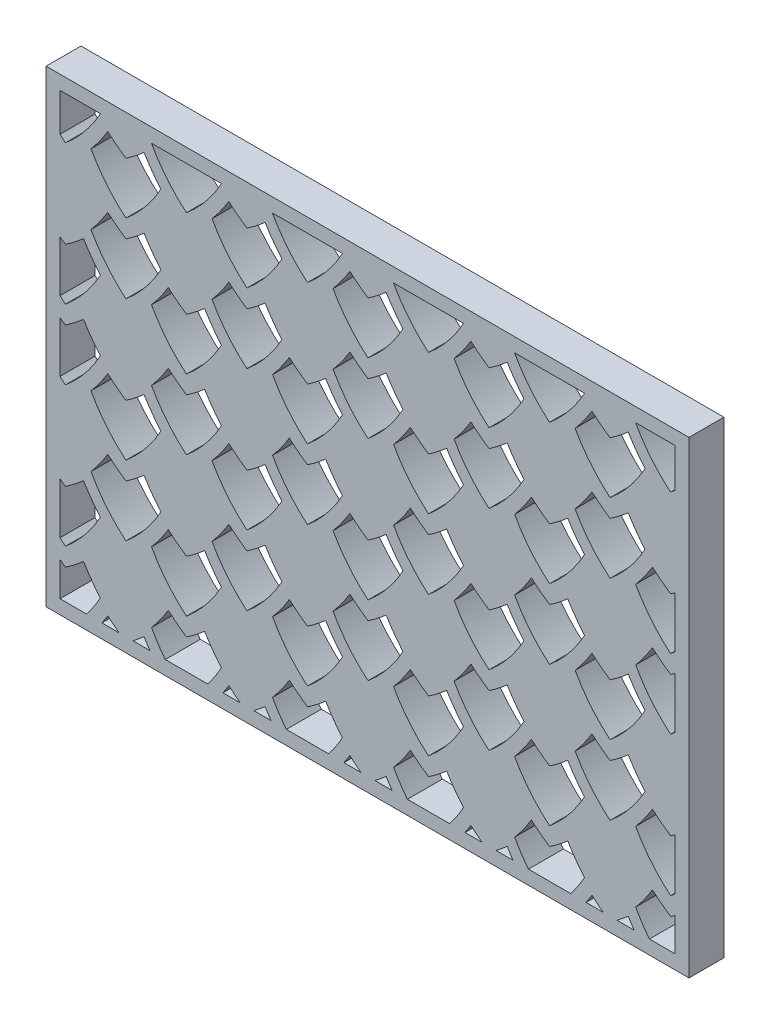
from build123d import *

# Parameters (mm, degrees)
SKETCH3_W           = 88
SKETCH3_H           = 63
BOSS_EXTRUDE2_DEPTH = 5
CUT_EXTRUDE1_DEPTH  = 70.169565835
SKETCH4_W           = 92
SKETCH4_H           = 67
SKETCH4_W_2         = 88
SKETCH4_H_2         = 63
BOSS_EXTRUDE3_DEPTH = 5


with BuildPart() as part:
    # Sketch3 → Boss-Extrude2 (new body)
    with BuildSketch(Plane.XY):
        with Locations((-6.36239225, 15.649319027)):
            Rectangle(SKETCH3_W, SKETCH3_H)
    extrude(amount=BOSS_EXTRUDE2_DEPTH)

    # Sketch1 → Cut-Extrude1 (cut, through all)
    with BuildSketch(Plane.XY):
        with BuildLine():
            ThreePointArc((-49.596586343, -68.963266791), (-52.378979429, -66.149375756), (-54.596645072, -62.871929626))
            ThreePointArc((-54.596645072, -62.871929626), (-53.324323575, -61.255666412), (-52.190717032, -59.539261747))
            ThreePointArc((-52.190717032, -59.539261747), (-50.926871084, -60.58383646), (-49.596586343, -61.542369412))
            ThreePointArc((-49.596586343, -61.542369412), (-48.266301602, -60.58383646), (-47.002455654, -59.539261747))
            ThreePointArc((-47.002455654, -59.539261747), (-45.868849111, -61.255666412), (-44.596527614, -62.871929626))
            ThreePointArc((-44.596527614, -62.871929626), (-46.814193257, -66.149375756), (-49.596586343, -68.963266791))
        make_face()
        with BuildLine():
            ThreePointArc((-40.936332305, -63.963266791), (-43.718725391, -61.149375756), (-45.936391034, -57.871929626))
            ThreePointArc((-45.936391034, -57.871929626), (-44.664069538, -56.255666412), (-43.530462994, -54.539261747))
            ThreePointArc((-43.530462994, -54.539261747), (-42.266617046, -55.58383646), (-40.936332305, -56.542369412))
            ThreePointArc((-40.936332305, -56.542369412), (-39.606047564, -55.58383646), (-38.342201616, -54.539261747))
            ThreePointArc((-38.342201616, -54.539261747), (-37.208595073, -56.255666412), (-35.936273576, -57.871929626))
            ThreePointArc((-35.936273576, -57.871929626), (-38.153939219, -61.149375756), (-40.936332305, -63.963266791))
        make_face()
        with BuildLine():
            ThreePointArc((-32.276078267, -58.963266791), (-35.058471353, -56.149375756), (-37.276136997, -52.871929626))
            ThreePointArc((-37.276136997, -52.871929626), (-36.0038155, -51.255666412), (-34.870208956, -49.539261747))
            ThreePointArc((-34.870208956, -49.539261747), (-33.606363008, -50.58383646), (-32.276078267, -51.542369412))
            ThreePointArc((-32.276078267, -51.542369412), (-30.945793527, -50.58383646), (-29.681947579, -49.539261747))
            ThreePointArc((-29.681947579, -49.539261747), (-28.548341035, -51.255666412), (-27.276019538, -52.871929626))
            ThreePointArc((-27.276019538, -52.871929626), (-29.493685181, -56.149375756), (-32.276078267, -58.963266791))
        make_face()
        with BuildLine():
            ThreePointArc((-23.61582423, -53.963266791), (-26.398217316, -51.149375756), (-28.615882959, -47.871929626))
            ThreePointArc((-28.615882959, -47.871929626), (-27.343561462, -46.255666412), (-26.209954918, -44.539261747))
            ThreePointArc((-26.209954918, -44.539261747), (-24.94610897, -45.58383646), (-23.61582423, -46.542369412))
            ThreePointArc((-23.61582423, -46.542369412), (-22.285539489, -45.58383646), (-21.021693541, -44.539261747))
            ThreePointArc((-21.021693541, -44.539261747), (-19.888086997, -46.255666412), (-18.6157655, -47.871929626))
            ThreePointArc((-18.6157655, -47.871929626), (-20.833431144, -51.149375756), (-23.61582423, -53.963266791))
        make_face()
        with BuildLine():
            ThreePointArc((-14.955570192, -48.963266791), (-17.737963278, -46.149375756), (-19.955628921, -42.871929626))
            ThreePointArc((-19.955628921, -42.871929626), (-18.683307424, -41.255666412), (-17.549700881, -39.539261747))
            ThreePointArc((-17.549700881, -39.539261747), (-16.285854933, -40.58383646), (-14.955570192, -41.542369412))
            ThreePointArc((-14.955570192, -41.542369412), (-13.625285451, -40.58383646), (-12.361439503, -39.539261747))
            ThreePointArc((-12.361439503, -39.539261747), (-11.227832959, -41.255666412), (-9.955511463, -42.871929626))
            ThreePointArc((-9.955511463, -42.871929626), (-12.173177106, -46.149375756), (-14.955570192, -48.963266791))
        make_face()
        with BuildLine():
            ThreePointArc((-6.295316154, -43.963266791), (-9.07770924, -41.149375756), (-11.295374883, -37.871929626))
            ThreePointArc((-11.295374883, -37.871929626), (-10.023053386, -36.255666412), (-8.889446843, -34.539261747))
            ThreePointArc((-8.889446843, -34.539261747), (-7.625600895, -35.58383646), (-6.295316154, -36.542369412))
            ThreePointArc((-6.295316154, -36.542369412), (-4.965031413, -35.58383646), (-3.701185465, -34.539261747))
            ThreePointArc((-3.701185465, -34.539261747), (-2.567578922, -36.255666412), (-1.295257425, -37.871929626))
            ThreePointArc((-1.295257425, -37.871929626), (-3.512923068, -41.149375756), (-6.295316154, -43.963266791))
        make_face()
        with BuildLine():
            ThreePointArc((2.364937884, -38.963266791), (-0.417455202, -36.149375756), (-2.635120845, -32.871929626))
            ThreePointArc((-2.635120845, -32.871929626), (-1.362799348, -31.255666412), (-0.229192805, -29.539261747))
            ThreePointArc((-0.229192805, -29.539261747), (1.034653143, -30.58383646), (2.364937884, -31.542369412))
            ThreePointArc((2.364937884, -31.542369412), (3.695222625, -30.58383646), (4.959068573, -29.539261747))
            ThreePointArc((4.959068573, -29.539261747), (6.092675116, -31.255666412), (7.364996613, -32.871929626))
            ThreePointArc((7.364996613, -32.871929626), (5.14733097, -36.149375756), (2.364937884, -38.963266791))
        make_face()
        with BuildLine():
            ThreePointArc((11.025191922, -33.963266791), (8.242798836, -31.149375756), (6.025133193, -27.871929626))
            ThreePointArc((6.025133193, -27.871929626), (7.29745469, -26.255666412), (8.431061233, -24.539261747))
            ThreePointArc((8.431061233, -24.539261747), (9.694907181, -25.58383646), (11.025191922, -26.542369412))
            ThreePointArc((11.025191922, -26.542369412), (12.355476663, -25.58383646), (13.619322611, -24.539261747))
            ThreePointArc((13.619322611, -24.539261747), (14.752929154, -26.255666412), (16.025250651, -27.871929626))
            ThreePointArc((16.025250651, -27.871929626), (13.807585008, -31.149375756), (11.025191922, -33.963266791))
        make_face()
        with BuildLine():
            ThreePointArc((28.345699997, -23.963266791), (25.563306912, -21.149375756), (23.345641268, -17.871929626))
            ThreePointArc((23.345641268, -17.871929626), (24.617962765, -16.255666412), (25.751569309, -14.539261747))
            ThreePointArc((25.751569309, -14.539261747), (27.015415257, -15.58383646), (28.345699997, -16.542369412))
            ThreePointArc((28.345699997, -16.542369412), (29.675984738, -15.58383646), (30.939830686, -14.539261747))
            ThreePointArc((30.939830686, -14.539261747), (32.07343723, -16.255666412), (33.345758727, -17.871929626))
            ThreePointArc((33.345758727, -17.871929626), (31.128093083, -21.149375756), (28.345699997, -23.963266791))
        make_face()
        with BuildLine():
            ThreePointArc((37.005954035, -18.963266791), (34.223560949, -16.149375756), (32.005895306, -12.871929626))
            ThreePointArc((32.005895306, -12.871929626), (33.278216803, -11.255666412), (34.411823347, -9.539261747))
            ThreePointArc((34.411823347, -9.539261747), (35.675669295, -10.58383646), (37.005954035, -11.542369412))
            ThreePointArc((37.005954035, -11.542369412), (38.336238776, -10.58383646), (39.600084724, -9.539261747))
            ThreePointArc((39.600084724, -9.539261747), (40.733691268, -11.255666412), (42.006012764, -12.871929626))
            ThreePointArc((42.006012764, -12.871929626), (39.788347121, -16.149375756), (37.005954035, -18.963266791))
        make_face()
        with BuildLine():
            ThreePointArc((-40.936332305, -53.963266791), (-43.718725391, -51.149375756), (-45.936391034, -47.871929626))
            ThreePointArc((-45.936391034, -47.871929626), (-44.664069538, -46.255666412), (-43.530462994, -44.539261747))
            ThreePointArc((-43.530462994, -44.539261747), (-42.266617046, -45.58383646), (-40.936332305, -46.542369412))
            ThreePointArc((-40.936332305, -46.542369412), (-39.606047564, -45.58383646), (-38.342201616, -44.539261747))
            ThreePointArc((-38.342201616, -44.539261747), (-37.208595073, -46.255666412), (-35.936273576, -47.871929626))
            ThreePointArc((-35.936273576, -47.871929626), (-38.153939219, -51.149375756), (-40.936332305, -53.963266791))
        make_face()
        with BuildLine():
            ThreePointArc((-32.276078267, -48.963266791), (-35.058471353, -46.149375756), (-37.276136997, -42.871929626))
            ThreePointArc((-37.276136997, -42.871929626), (-36.0038155, -41.255666412), (-34.870208956, -39.539261747))
            ThreePointArc((-34.870208956, -39.539261747), (-33.606363008, -40.58383646), (-32.276078267, -41.542369412))
            ThreePointArc((-32.276078267, -41.542369412), (-30.945793527, -40.58383646), (-29.681947579, -39.539261747))
            ThreePointArc((-29.681947579, -39.539261747), (-28.548341035, -41.255666412), (-27.276019538, -42.871929626))
            ThreePointArc((-27.276019538, -42.871929626), (-29.493685181, -46.149375756), (-32.276078267, -48.963266791))
        make_face()
        with BuildLine():
            ThreePointArc((-23.61582423, -43.963266791), (-26.398217316, -41.149375756), (-28.615882959, -37.871929626))
            ThreePointArc((-28.615882959, -37.871929626), (-27.343561462, -36.255666412), (-26.209954918, -34.539261747))
            ThreePointArc((-26.209954918, -34.539261747), (-24.94610897, -35.58383646), (-23.61582423, -36.542369412))
            ThreePointArc((-23.61582423, -36.542369412), (-22.285539489, -35.58383646), (-21.021693541, -34.539261747))
            ThreePointArc((-21.021693541, -34.539261747), (-19.888086997, -36.255666412), (-18.6157655, -37.871929626))
            ThreePointArc((-18.6157655, -37.871929626), (-20.833431144, -41.149375756), (-23.61582423, -43.963266791))
        make_face()
        with BuildLine():
            ThreePointArc((-14.955570192, -38.963266791), (-17.737963278, -36.149375756), (-19.955628921, -32.871929626))
            ThreePointArc((-19.955628921, -32.871929626), (-18.683307424, -31.255666412), (-17.549700881, -29.539261747))
            ThreePointArc((-17.549700881, -29.539261747), (-16.285854933, -30.58383646), (-14.955570192, -31.542369412))
            ThreePointArc((-14.955570192, -31.542369412), (-13.625285451, -30.58383646), (-12.361439503, -29.539261747))
            ThreePointArc((-12.361439503, -29.539261747), (-11.227832959, -31.255666412), (-9.955511463, -32.871929626))
            ThreePointArc((-9.955511463, -32.871929626), (-12.173177106, -36.149375756), (-14.955570192, -38.963266791))
        make_face()
        with BuildLine():
            ThreePointArc((-6.295316154, -33.963266791), (-9.07770924, -31.149375756), (-11.295374883, -27.871929626))
            ThreePointArc((-11.295374883, -27.871929626), (-10.023053386, -26.255666412), (-8.889446843, -24.539261747))
            ThreePointArc((-8.889446843, -24.539261747), (-7.625600895, -25.58383646), (-6.295316154, -26.542369412))
            ThreePointArc((-6.295316154, -26.542369412), (-4.965031413, -25.58383646), (-3.701185465, -24.539261747))
            ThreePointArc((-3.701185465, -24.539261747), (-2.567578922, -26.255666412), (-1.295257425, -27.871929626))
            ThreePointArc((-1.295257425, -27.871929626), (-3.512923068, -31.149375756), (-6.295316154, -33.963266791))
        make_face()
        with BuildLine():
            ThreePointArc((11.025191922, -23.963266791), (8.242798836, -21.149375756), (6.025133193, -17.871929626))
            ThreePointArc((6.025133193, -17.871929626), (7.29745469, -16.255666412), (8.431061233, -14.539261747))
            ThreePointArc((8.431061233, -14.539261747), (9.694907181, -15.58383646), (11.025191922, -16.542369412))
            ThreePointArc((11.025191922, -16.542369412), (12.355476663, -15.58383646), (13.619322611, -14.539261747))
            ThreePointArc((13.619322611, -14.539261747), (14.752929154, -16.255666412), (16.025250651, -17.871929626))
            ThreePointArc((16.025250651, -17.871929626), (13.807585008, -21.149375756), (11.025191922, -23.963266791))
        make_face()
        with BuildLine():
            ThreePointArc((19.68544596, -18.963266791), (16.903052874, -16.149375756), (14.685387231, -12.871929626))
            ThreePointArc((14.685387231, -12.871929626), (15.957708727, -11.255666412), (17.091315271, -9.539261747))
            ThreePointArc((17.091315271, -9.539261747), (18.355161219, -10.58383646), (19.68544596, -11.542369412))
            ThreePointArc((19.68544596, -11.542369412), (21.0157307, -10.58383646), (22.279576648, -9.539261747))
            ThreePointArc((22.279576648, -9.539261747), (23.413183192, -11.255666412), (24.685504689, -12.871929626))
            ThreePointArc((24.685504689, -12.871929626), (22.467839046, -16.149375756), (19.68544596, -18.963266791))
        make_face()
        with BuildLine():
            ThreePointArc((37.005954035, -8.963266791), (34.223560949, -6.149375756), (32.005895306, -2.871929626))
            ThreePointArc((32.005895306, -2.871929626), (33.278216803, -1.255666412), (34.411823347, 0.460738253))
            ThreePointArc((34.411823347, 0.460738253), (35.675669295, -0.58383646), (37.005954035, -1.542369412))
            ThreePointArc((37.005954035, -1.542369412), (38.336238776, -0.58383646), (39.600084724, 0.460738253))
            ThreePointArc((39.600084724, 0.460738253), (40.733691268, -1.255666412), (42.006012764, -2.871929626))
            ThreePointArc((42.006012764, -2.871929626), (39.788347121, -6.149375756), (37.005954035, -8.963266791))
        make_face()
        with BuildLine():
            ThreePointArc((-40.936332305, -43.963266791), (-43.718725391, -41.149375756), (-45.936391034, -37.871929626))
            ThreePointArc((-45.936391034, -37.871929626), (-44.664069538, -36.255666412), (-43.530462994, -34.539261747))
            ThreePointArc((-43.530462994, -34.539261747), (-42.266617046, -35.58383646), (-40.936332305, -36.542369412))
            ThreePointArc((-40.936332305, -36.542369412), (-39.606047564, -35.58383646), (-38.342201616, -34.539261747))
            ThreePointArc((-38.342201616, -34.539261747), (-37.208595073, -36.255666412), (-35.936273576, -37.871929626))
            ThreePointArc((-35.936273576, -37.871929626), (-38.153939219, -41.149375756), (-40.936332305, -43.963266791))
        make_face()
        with BuildLine():
            ThreePointArc((-32.276078267, -38.963266791), (-35.058471353, -36.149375756), (-37.276136997, -32.871929626))
            ThreePointArc((-37.276136997, -32.871929626), (-36.0038155, -31.255666412), (-34.870208956, -29.539261747))
            ThreePointArc((-34.870208956, -29.539261747), (-33.606363008, -30.58383646), (-32.276078267, -31.542369412))
            ThreePointArc((-32.276078267, -31.542369412), (-30.945793527, -30.58383646), (-29.681947579, -29.539261747))
            ThreePointArc((-29.681947579, -29.539261747), (-28.548341035, -31.255666412), (-27.276019538, -32.871929626))
            ThreePointArc((-27.276019538, -32.871929626), (-29.493685181, -36.149375756), (-32.276078267, -38.963266791))
        make_face()
        with BuildLine():
            ThreePointArc((-23.61582423, -33.963266791), (-26.398217316, -31.149375756), (-28.615882959, -27.871929626))
            ThreePointArc((-28.615882959, -27.871929626), (-27.343561462, -26.255666412), (-26.209954918, -24.539261747))
            ThreePointArc((-26.209954918, -24.539261747), (-24.94610897, -25.58383646), (-23.61582423, -26.542369412))
            ThreePointArc((-23.61582423, -26.542369412), (-22.285539489, -25.58383646), (-21.021693541, -24.539261747))
            ThreePointArc((-21.021693541, -24.539261747), (-19.888086997, -26.255666412), (-18.6157655, -27.871929626))
            ThreePointArc((-18.6157655, -27.871929626), (-20.833431144, -31.149375756), (-23.61582423, -33.963266791))
        make_face()
        with BuildLine():
            ThreePointArc((-6.295316154, -23.963266791), (-9.07770924, -21.149375756), (-11.295374883, -17.871929626))
            ThreePointArc((-11.295374883, -17.871929626), (-10.023053386, -16.255666412), (-8.889446843, -14.539261747))
            ThreePointArc((-8.889446843, -14.539261747), (-7.625600895, -15.58383646), (-6.295316154, -16.542369412))
            ThreePointArc((-6.295316154, -16.542369412), (-4.965031413, -15.58383646), (-3.701185465, -14.539261747))
            ThreePointArc((-3.701185465, -14.539261747), (-2.567578922, -16.255666412), (-1.295257425, -17.871929626))
            ThreePointArc((-1.295257425, -17.871929626), (-3.512923068, -21.149375756), (-6.295316154, -23.963266791))
        make_face()
        with BuildLine():
            ThreePointArc((2.364937884, -18.963266791), (-0.417455202, -16.149375756), (-2.635120845, -12.871929626))
            ThreePointArc((-2.635120845, -12.871929626), (-1.362799348, -11.255666412), (-0.229192805, -9.539261747))
            ThreePointArc((-0.229192805, -9.539261747), (1.034653143, -10.58383646), (2.364937884, -11.542369412))
            ThreePointArc((2.364937884, -11.542369412), (3.695222625, -10.58383646), (4.959068573, -9.539261747))
            ThreePointArc((4.959068573, -9.539261747), (6.092675116, -11.255666412), (7.364996613, -12.871929626))
            ThreePointArc((7.364996613, -12.871929626), (5.14733097, -16.149375756), (2.364937884, -18.963266791))
        make_face()
        with BuildLine():
            ThreePointArc((19.68544596, -8.963266791), (16.903052874, -6.149375756), (14.685387231, -2.871929626))
            ThreePointArc((14.685387231, -2.871929626), (15.957708727, -1.255666412), (17.091315271, 0.460738253))
            ThreePointArc((17.091315271, 0.460738253), (18.355161219, -0.58383646), (19.68544596, -1.542369412))
            ThreePointArc((19.68544596, -1.542369412), (21.0157307, -0.58383646), (22.279576648, 0.460738253))
            ThreePointArc((22.279576648, 0.460738253), (23.413183192, -1.255666412), (24.685504689, -2.871929626))
            ThreePointArc((24.685504689, -2.871929626), (22.467839046, -6.149375756), (19.68544596, -8.963266791))
        make_face()
        with BuildLine():
            ThreePointArc((28.345699997, -3.963266791), (25.563306912, -1.149375756), (23.345641268, 2.128070374))
            ThreePointArc((23.345641268, 2.128070374), (24.617962765, 3.744333588), (25.751569309, 5.460738253))
            ThreePointArc((25.751569309, 5.460738253), (27.015415257, 4.41616354), (28.345699997, 3.457630588))
            ThreePointArc((28.345699997, 3.457630588), (29.675984738, 4.41616354), (30.939830686, 5.460738253))
            ThreePointArc((30.939830686, 5.460738253), (32.07343723, 3.744333588), (33.345758727, 2.128070374))
            ThreePointArc((33.345758727, 2.128070374), (31.128093083, -1.149375756), (28.345699997, -3.963266791))
        make_face()
        with BuildLine():
            ThreePointArc((-40.936332305, -33.963266791), (-43.718725391, -31.149375756), (-45.936391034, -27.871929626))
            ThreePointArc((-45.936391034, -27.871929626), (-44.664069538, -26.255666412), (-43.530462994, -24.539261747))
            ThreePointArc((-43.530462994, -24.539261747), (-42.266617046, -25.58383646), (-40.936332305, -26.542369412))
            ThreePointArc((-40.936332305, -26.542369412), (-39.606047564, -25.58383646), (-38.342201616, -24.539261747))
            ThreePointArc((-38.342201616, -24.539261747), (-37.208595073, -26.255666412), (-35.936273576, -27.871929626))
            ThreePointArc((-35.936273576, -27.871929626), (-38.153939219, -31.149375756), (-40.936332305, -33.963266791))
        make_face()
        with BuildLine():
            ThreePointArc((-23.61582423, -23.963266791), (-26.398217316, -21.149375756), (-28.615882959, -17.871929626))
            ThreePointArc((-28.615882959, -17.871929626), (-27.343561462, -16.255666412), (-26.209954918, -14.539261747))
            ThreePointArc((-26.209954918, -14.539261747), (-24.94610897, -15.58383646), (-23.61582423, -16.542369412))
            ThreePointArc((-23.61582423, -16.542369412), (-22.285539489, -15.58383646), (-21.021693541, -14.539261747))
            ThreePointArc((-21.021693541, -14.539261747), (-19.888086997, -16.255666412), (-18.6157655, -17.871929626))
            ThreePointArc((-18.6157655, -17.871929626), (-20.833431144, -21.149375756), (-23.61582423, -23.963266791))
        make_face()
        with BuildLine():
            ThreePointArc((-14.955570192, -18.963266791), (-17.737963278, -16.149375756), (-19.955628921, -12.871929626))
            ThreePointArc((-19.955628921, -12.871929626), (-18.683307424, -11.255666412), (-17.549700881, -9.539261747))
            ThreePointArc((-17.549700881, -9.539261747), (-16.285854933, -10.58383646), (-14.955570192, -11.542369412))
            ThreePointArc((-14.955570192, -11.542369412), (-13.625285451, -10.58383646), (-12.361439503, -9.539261747))
            ThreePointArc((-12.361439503, -9.539261747), (-11.227832959, -11.255666412), (-9.955511463, -12.871929626))
            ThreePointArc((-9.955511463, -12.871929626), (-12.173177106, -16.149375756), (-14.955570192, -18.963266791))
        make_face()
        with BuildLine():
            ThreePointArc((2.364937884, -8.963266791), (-0.417455202, -6.149375756), (-2.635120845, -2.871929626))
            ThreePointArc((-2.635120845, -2.871929626), (-1.362799348, -1.255666412), (-0.229192805, 0.460738253))
            ThreePointArc((-0.229192805, 0.460738253), (1.034653143, -0.58383646), (2.364937884, -1.542369412))
            ThreePointArc((2.364937884, -1.542369412), (3.695222625, -0.58383646), (4.959068573, 0.460738253))
            ThreePointArc((4.959068573, 0.460738253), (6.092675116, -1.255666412), (7.364996613, -2.871929626))
            ThreePointArc((7.364996613, -2.871929626), (5.14733097, -6.149375756), (2.364937884, -8.963266791))
        make_face()
        with BuildLine():
            ThreePointArc((11.025191922, -3.963266791), (8.242798836, -1.149375756), (6.025133193, 2.128070374))
            ThreePointArc((6.025133193, 2.128070374), (7.29745469, 3.744333588), (8.431061233, 5.460738253))
            ThreePointArc((8.431061233, 5.460738253), (9.694907181, 4.41616354), (11.025191922, 3.457630588))
            ThreePointArc((11.025191922, 3.457630588), (12.355476663, 4.41616354), (13.619322611, 5.460738253))
            ThreePointArc((13.619322611, 5.460738253), (14.752929154, 3.744333588), (16.025250651, 2.128070374))
            ThreePointArc((16.025250651, 2.128070374), (13.807585008, -1.149375756), (11.025191922, -3.963266791))
        make_face()
        with BuildLine():
            ThreePointArc((28.345699997, 6.036733209), (25.563306912, 8.850624244), (23.345641268, 12.128070374))
            ThreePointArc((23.345641268, 12.128070374), (24.617962765, 13.744333588), (25.751569309, 15.460738253))
            ThreePointArc((25.751569309, 15.460738253), (27.015415257, 14.41616354), (28.345699997, 13.457630588))
            ThreePointArc((28.345699997, 13.457630588), (29.675984738, 14.41616354), (30.939830686, 15.460738253))
            ThreePointArc((30.939830686, 15.460738253), (32.07343723, 13.744333588), (33.345758727, 12.128070374))
            ThreePointArc((33.345758727, 12.128070374), (31.128093083, 8.850624244), (28.345699997, 6.036733209))
        make_face()
        with BuildLine():
            ThreePointArc((37.005954035, 11.036733209), (34.223560949, 13.850624244), (32.005895306, 17.128070374))
            ThreePointArc((32.005895306, 17.128070374), (33.278216803, 18.744333588), (34.411823347, 20.460738253))
            ThreePointArc((34.411823347, 20.460738253), (35.675669295, 19.41616354), (37.005954035, 18.457630588))
            ThreePointArc((37.005954035, 18.457630588), (38.336238776, 19.41616354), (39.600084724, 20.460738253))
            ThreePointArc((39.600084724, 20.460738253), (40.733691268, 18.744333588), (42.006012764, 17.128070374))
            ThreePointArc((42.006012764, 17.128070374), (39.788347121, 13.850624244), (37.005954035, 11.036733209))
        make_face()
        with BuildLine():
            ThreePointArc((-40.936332305, -23.963266791), (-43.718725391, -21.149375756), (-45.936391034, -17.871929626))
            ThreePointArc((-45.936391034, -17.871929626), (-44.664069538, -16.255666412), (-43.530462994, -14.539261747))
            ThreePointArc((-43.530462994, -14.539261747), (-42.266617046, -15.58383646), (-40.936332305, -16.542369412))
            ThreePointArc((-40.936332305, -16.542369412), (-39.606047564, -15.58383646), (-38.342201616, -14.539261747))
            ThreePointArc((-38.342201616, -14.539261747), (-37.208595073, -16.255666412), (-35.936273576, -17.871929626))
            ThreePointArc((-35.936273576, -17.871929626), (-38.153939219, -21.149375756), (-40.936332305, -23.963266791))
        make_face()
        with BuildLine():
            ThreePointArc((-32.276078267, -18.963266791), (-35.058471353, -16.149375756), (-37.276136997, -12.871929626))
            ThreePointArc((-37.276136997, -12.871929626), (-36.0038155, -11.255666412), (-34.870208956, -9.539261747))
            ThreePointArc((-34.870208956, -9.539261747), (-33.606363008, -10.58383646), (-32.276078267, -11.542369412))
            ThreePointArc((-32.276078267, -11.542369412), (-30.945793527, -10.58383646), (-29.681947579, -9.539261747))
            ThreePointArc((-29.681947579, -9.539261747), (-28.548341035, -11.255666412), (-27.276019538, -12.871929626))
            ThreePointArc((-27.276019538, -12.871929626), (-29.493685181, -16.149375756), (-32.276078267, -18.963266791))
        make_face()
        with BuildLine():
            ThreePointArc((-14.955570192, -8.963266791), (-17.737963278, -6.149375756), (-19.955628921, -2.871929626))
            ThreePointArc((-19.955628921, -2.871929626), (-18.683307424, -1.255666412), (-17.549700881, 0.460738253))
            ThreePointArc((-17.549700881, 0.460738253), (-16.285854933, -0.58383646), (-14.955570192, -1.542369412))
            ThreePointArc((-14.955570192, -1.542369412), (-13.625285451, -0.58383646), (-12.361439503, 0.460738253))
            ThreePointArc((-12.361439503, 0.460738253), (-11.227832959, -1.255666412), (-9.955511463, -2.871929626))
            ThreePointArc((-9.955511463, -2.871929626), (-12.173177106, -6.149375756), (-14.955570192, -8.963266791))
        make_face()
        with BuildLine():
            ThreePointArc((-6.295316154, -3.963266791), (-9.07770924, -1.149375756), (-11.295374883, 2.128070374))
            ThreePointArc((-11.295374883, 2.128070374), (-10.023053386, 3.744333588), (-8.889446843, 5.460738253))
            ThreePointArc((-8.889446843, 5.460738253), (-7.625600895, 4.41616354), (-6.295316154, 3.457630588))
            ThreePointArc((-6.295316154, 3.457630588), (-4.965031413, 4.41616354), (-3.701185465, 5.460738253))
            ThreePointArc((-3.701185465, 5.460738253), (-2.567578922, 3.744333588), (-1.295257425, 2.128070374))
            ThreePointArc((-1.295257425, 2.128070374), (-3.512923068, -1.149375756), (-6.295316154, -3.963266791))
        make_face()
        with BuildLine():
            ThreePointArc((11.025191922, 6.036733209), (8.242798836, 8.850624244), (6.025133193, 12.128070374))
            ThreePointArc((6.025133193, 12.128070374), (7.29745469, 13.744333588), (8.431061233, 15.460738253))
            ThreePointArc((8.431061233, 15.460738253), (9.694907181, 14.41616354), (11.025191922, 13.457630588))
            ThreePointArc((11.025191922, 13.457630588), (12.355476663, 14.41616354), (13.619322611, 15.460738253))
            ThreePointArc((13.619322611, 15.460738253), (14.752929154, 13.744333588), (16.025250651, 12.128070374))
            ThreePointArc((16.025250651, 12.128070374), (13.807585008, 8.850624244), (11.025191922, 6.036733209))
        make_face()
        with BuildLine():
            ThreePointArc((19.68544596, 11.036733209), (16.903052874, 13.850624244), (14.685387231, 17.128070374))
            ThreePointArc((14.685387231, 17.128070374), (15.957708727, 18.744333588), (17.091315271, 20.460738253))
            ThreePointArc((17.091315271, 20.460738253), (18.355161219, 19.41616354), (19.68544596, 18.457630588))
            ThreePointArc((19.68544596, 18.457630588), (21.0157307, 19.41616354), (22.279576648, 20.460738253))
            ThreePointArc((22.279576648, 20.460738253), (23.413183192, 18.744333588), (24.685504689, 17.128070374))
            ThreePointArc((24.685504689, 17.128070374), (22.467839046, 13.850624244), (19.68544596, 11.036733209))
        make_face()
        with BuildLine():
            ThreePointArc((37.005954035, 21.036733209), (34.223560949, 23.850624244), (32.005895306, 27.128070374))
            ThreePointArc((32.005895306, 27.128070374), (33.278216803, 28.744333588), (34.411823347, 30.460738253))
            ThreePointArc((34.411823347, 30.460738253), (35.675669295, 29.41616354), (37.005954035, 28.457630588))
            ThreePointArc((37.005954035, 28.457630588), (38.336238776, 29.41616354), (39.600084724, 30.460738253))
            ThreePointArc((39.600084724, 30.460738253), (40.733691268, 28.744333588), (42.006012764, 27.128070374))
            ThreePointArc((42.006012764, 27.128070374), (39.788347121, 23.850624244), (37.005954035, 21.036733209))
        make_face()
        with BuildLine():
            ThreePointArc((-32.276078267, -8.963266791), (-35.058471353, -6.149375756), (-37.276136997, -2.871929626))
            ThreePointArc((-37.276136997, -2.871929626), (-36.0038155, -1.255666412), (-34.870208956, 0.460738253))
            ThreePointArc((-34.870208956, 0.460738253), (-33.606363008, -0.58383646), (-32.276078267, -1.542369412))
            ThreePointArc((-32.276078267, -1.542369412), (-30.945793527, -0.58383646), (-29.681947579, 0.460738253))
            ThreePointArc((-29.681947579, 0.460738253), (-28.548341035, -1.255666412), (-27.276019538, -2.871929626))
            ThreePointArc((-27.276019538, -2.871929626), (-29.493685181, -6.149375756), (-32.276078267, -8.963266791))
        make_face()
        with BuildLine():
            ThreePointArc((-23.61582423, -3.963266791), (-26.398217316, -1.149375756), (-28.615882959, 2.128070374))
            ThreePointArc((-28.615882959, 2.128070374), (-27.343561462, 3.744333588), (-26.209954918, 5.460738253))
            ThreePointArc((-26.209954918, 5.460738253), (-24.94610897, 4.41616354), (-23.61582423, 3.457630588))
            ThreePointArc((-23.61582423, 3.457630588), (-22.285539489, 4.41616354), (-21.021693541, 5.460738253))
            ThreePointArc((-21.021693541, 5.460738253), (-19.888086997, 3.744333588), (-18.6157655, 2.128070374))
            ThreePointArc((-18.6157655, 2.128070374), (-20.833431144, -1.149375756), (-23.61582423, -3.963266791))
        make_face()
        with BuildLine():
            ThreePointArc((-6.295316154, 6.036733209), (-9.07770924, 8.850624244), (-11.295374883, 12.128070374))
            ThreePointArc((-11.295374883, 12.128070374), (-10.023053386, 13.744333588), (-8.889446843, 15.460738253))
            ThreePointArc((-8.889446843, 15.460738253), (-7.625600895, 14.41616354), (-6.295316154, 13.457630588))
            ThreePointArc((-6.295316154, 13.457630588), (-4.965031413, 14.41616354), (-3.701185465, 15.460738253))
            ThreePointArc((-3.701185465, 15.460738253), (-2.567578922, 13.744333588), (-1.295257425, 12.128070374))
            ThreePointArc((-1.295257425, 12.128070374), (-3.512923068, 8.850624244), (-6.295316154, 6.036733209))
        make_face()
        with BuildLine():
            ThreePointArc((2.364937884, 11.036733209), (-0.417455202, 13.850624244), (-2.635120845, 17.128070374))
            ThreePointArc((-2.635120845, 17.128070374), (-1.362799348, 18.744333588), (-0.229192805, 20.460738253))
            ThreePointArc((-0.229192805, 20.460738253), (1.034653143, 19.41616354), (2.364937884, 18.457630588))
            ThreePointArc((2.364937884, 18.457630588), (3.695222625, 19.41616354), (4.959068573, 20.460738253))
            ThreePointArc((4.959068573, 20.460738253), (6.092675116, 18.744333588), (7.364996613, 17.128070374))
            ThreePointArc((7.364996613, 17.128070374), (5.14733097, 13.850624244), (2.364937884, 11.036733209))
        make_face()
        with BuildLine():
            ThreePointArc((19.68544596, 21.036733209), (16.903052874, 23.850624244), (14.685387231, 27.128070374))
            ThreePointArc((14.685387231, 27.128070374), (15.957708727, 28.744333588), (17.091315271, 30.460738253))
            ThreePointArc((17.091315271, 30.460738253), (18.355161219, 29.41616354), (19.68544596, 28.457630588))
            ThreePointArc((19.68544596, 28.457630588), (21.0157307, 29.41616354), (22.279576648, 30.460738253))
            ThreePointArc((22.279576648, 30.460738253), (23.413183192, 28.744333588), (24.685504689, 27.128070374))
            ThreePointArc((24.685504689, 27.128070374), (22.467839046, 23.850624244), (19.68544596, 21.036733209))
        make_face()
        with BuildLine():
            ThreePointArc((28.345699997, 26.036733209), (25.563306912, 28.850624244), (23.345641268, 32.128070374))
            ThreePointArc((23.345641268, 32.128070374), (24.617962765, 33.744333588), (25.751569309, 35.460738253))
            ThreePointArc((25.751569309, 35.460738253), (27.015415257, 34.41616354), (28.345699997, 33.457630588))
            ThreePointArc((28.345699997, 33.457630588), (29.675984738, 34.41616354), (30.939830686, 35.460738253))
            ThreePointArc((30.939830686, 35.460738253), (32.07343723, 33.744333588), (33.345758727, 32.128070374))
            ThreePointArc((33.345758727, 32.128070374), (31.128093083, 28.850624244), (28.345699997, 26.036733209))
        make_face()
        with BuildLine():
            ThreePointArc((-40.936332305, -3.963266791), (-43.718725391, -1.149375756), (-45.936391034, 2.128070374))
            ThreePointArc((-45.936391034, 2.128070374), (-44.664069538, 3.744333588), (-43.530462994, 5.460738253))
            ThreePointArc((-43.530462994, 5.460738253), (-42.266617046, 4.41616354), (-40.936332305, 3.457630588))
            ThreePointArc((-40.936332305, 3.457630588), (-39.606047564, 4.41616354), (-38.342201616, 5.460738253))
            ThreePointArc((-38.342201616, 5.460738253), (-37.208595073, 3.744333588), (-35.936273576, 2.128070374))
            ThreePointArc((-35.936273576, 2.128070374), (-38.153939219, -1.149375756), (-40.936332305, -3.963266791))
        make_face()
        with BuildLine():
            ThreePointArc((-23.61582423, 6.036733209), (-26.398217316, 8.850624244), (-28.615882959, 12.128070374))
            ThreePointArc((-28.615882959, 12.128070374), (-27.343561462, 13.744333588), (-26.209954918, 15.460738253))
            ThreePointArc((-26.209954918, 15.460738253), (-24.94610897, 14.41616354), (-23.61582423, 13.457630588))
            ThreePointArc((-23.61582423, 13.457630588), (-22.285539489, 14.41616354), (-21.021693541, 15.460738253))
            ThreePointArc((-21.021693541, 15.460738253), (-19.888086997, 13.744333588), (-18.6157655, 12.128070374))
            ThreePointArc((-18.6157655, 12.128070374), (-20.833431144, 8.850624244), (-23.61582423, 6.036733209))
        make_face()
        with BuildLine():
            ThreePointArc((-14.955570192, 11.036733209), (-17.737963278, 13.850624244), (-19.955628921, 17.128070374))
            ThreePointArc((-19.955628921, 17.128070374), (-18.683307424, 18.744333588), (-17.549700881, 20.460738253))
            ThreePointArc((-17.549700881, 20.460738253), (-16.285854933, 19.41616354), (-14.955570192, 18.457630588))
            ThreePointArc((-14.955570192, 18.457630588), (-13.625285451, 19.41616354), (-12.361439503, 20.460738253))
            ThreePointArc((-12.361439503, 20.460738253), (-11.227832959, 18.744333588), (-9.955511463, 17.128070374))
            ThreePointArc((-9.955511463, 17.128070374), (-12.173177106, 13.850624244), (-14.955570192, 11.036733209))
        make_face()
        with BuildLine():
            ThreePointArc((2.364937884, 21.036733209), (-0.417455202, 23.850624244), (-2.635120845, 27.128070374))
            ThreePointArc((-2.635120845, 27.128070374), (-1.362799348, 28.744333588), (-0.229192805, 30.460738253))
            ThreePointArc((-0.229192805, 30.460738253), (1.034653143, 29.41616354), (2.364937884, 28.457630588))
            ThreePointArc((2.364937884, 28.457630588), (3.695222625, 29.41616354), (4.959068573, 30.460738253))
            ThreePointArc((4.959068573, 30.460738253), (6.092675116, 28.744333588), (7.364996613, 27.128070374))
            ThreePointArc((7.364996613, 27.128070374), (5.14733097, 23.850624244), (2.364937884, 21.036733209))
        make_face()
        with BuildLine():
            ThreePointArc((11.025191922, 26.036733209), (8.242798836, 28.850624244), (6.025133193, 32.128070374))
            ThreePointArc((6.025133193, 32.128070374), (7.29745469, 33.744333588), (8.431061233, 35.460738253))
            ThreePointArc((8.431061233, 35.460738253), (9.694907181, 34.41616354), (11.025191922, 33.457630588))
            ThreePointArc((11.025191922, 33.457630588), (12.355476663, 34.41616354), (13.619322611, 35.460738253))
            ThreePointArc((13.619322611, 35.460738253), (14.752929154, 33.744333588), (16.025250651, 32.128070374))
            ThreePointArc((16.025250651, 32.128070374), (13.807585008, 28.850624244), (11.025191922, 26.036733209))
        make_face()
        with BuildLine():
            ThreePointArc((28.345699997, 36.036733209), (25.563306912, 38.850624244), (23.345641268, 42.128070374))
            ThreePointArc((23.345641268, 42.128070374), (24.617962765, 43.744333588), (25.751569309, 45.460738253))
            ThreePointArc((25.751569309, 45.460738253), (27.015415257, 44.41616354), (28.345699997, 43.457630588))
            ThreePointArc((28.345699997, 43.457630588), (29.675984738, 44.41616354), (30.939830686, 45.460738253))
            ThreePointArc((30.939830686, 45.460738253), (32.07343723, 43.744333588), (33.345758727, 42.128070374))
            ThreePointArc((33.345758727, 42.128070374), (31.128093083, 38.850624244), (28.345699997, 36.036733209))
        make_face()
        with BuildLine():
            ThreePointArc((37.005954035, 41.036733209), (34.223560949, 43.850624244), (32.005895306, 47.128070374))
            ThreePointArc((32.005895306, 47.128070374), (33.278216803, 48.744333588), (34.411823347, 50.460738253))
            ThreePointArc((34.411823347, 50.460738253), (35.675669295, 49.41616354), (37.005954035, 48.457630588))
            ThreePointArc((37.005954035, 48.457630588), (38.336238776, 49.41616354), (39.600084724, 50.460738253))
            ThreePointArc((39.600084724, 50.460738253), (40.733691268, 48.744333588), (42.006012764, 47.128070374))
            ThreePointArc((42.006012764, 47.128070374), (39.788347121, 43.850624244), (37.005954035, 41.036733209))
        make_face()
        with BuildLine():
            ThreePointArc((-40.936332305, 6.036733209), (-43.718725391, 8.850624244), (-45.936391034, 12.128070374))
            ThreePointArc((-45.936391034, 12.128070374), (-44.664069538, 13.744333588), (-43.530462994, 15.460738253))
            ThreePointArc((-43.530462994, 15.460738253), (-42.266617046, 14.41616354), (-40.936332305, 13.457630588))
            ThreePointArc((-40.936332305, 13.457630588), (-39.606047564, 14.41616354), (-38.342201616, 15.460738253))
            ThreePointArc((-38.342201616, 15.460738253), (-37.208595073, 13.744333588), (-35.936273576, 12.128070374))
            ThreePointArc((-35.936273576, 12.128070374), (-38.153939219, 8.850624244), (-40.936332305, 6.036733209))
        make_face()
        with BuildLine():
            ThreePointArc((-32.276078267, 11.036733209), (-35.058471353, 13.850624244), (-37.276136997, 17.128070374))
            ThreePointArc((-37.276136997, 17.128070374), (-36.0038155, 18.744333588), (-34.870208956, 20.460738253))
            ThreePointArc((-34.870208956, 20.460738253), (-33.606363008, 19.41616354), (-32.276078267, 18.457630588))
            ThreePointArc((-32.276078267, 18.457630588), (-30.945793527, 19.41616354), (-29.681947579, 20.460738253))
            ThreePointArc((-29.681947579, 20.460738253), (-28.548341035, 18.744333588), (-27.276019538, 17.128070374))
            ThreePointArc((-27.276019538, 17.128070374), (-29.493685181, 13.850624244), (-32.276078267, 11.036733209))
        make_face()
        with BuildLine():
            ThreePointArc((-14.955570192, 21.036733209), (-17.737963278, 23.850624244), (-19.955628921, 27.128070374))
            ThreePointArc((-19.955628921, 27.128070374), (-18.683307424, 28.744333588), (-17.549700881, 30.460738253))
            ThreePointArc((-17.549700881, 30.460738253), (-16.285854933, 29.41616354), (-14.955570192, 28.457630588))
            ThreePointArc((-14.955570192, 28.457630588), (-13.625285451, 29.41616354), (-12.361439503, 30.460738253))
            ThreePointArc((-12.361439503, 30.460738253), (-11.227832959, 28.744333588), (-9.955511463, 27.128070374))
            ThreePointArc((-9.955511463, 27.128070374), (-12.173177106, 23.850624244), (-14.955570192, 21.036733209))
        make_face()
        with BuildLine():
            ThreePointArc((-6.295316154, 26.036733209), (-9.07770924, 28.850624244), (-11.295374883, 32.128070374))
            ThreePointArc((-11.295374883, 32.128070374), (-10.023053386, 33.744333588), (-8.889446843, 35.460738253))
            ThreePointArc((-8.889446843, 35.460738253), (-7.625600895, 34.41616354), (-6.295316154, 33.457630588))
            ThreePointArc((-6.295316154, 33.457630588), (-4.965031413, 34.41616354), (-3.701185465, 35.460738253))
            ThreePointArc((-3.701185465, 35.460738253), (-2.567578922, 33.744333588), (-1.295257425, 32.128070374))
            ThreePointArc((-1.295257425, 32.128070374), (-3.512923068, 28.850624244), (-6.295316154, 26.036733209))
        make_face()
        with BuildLine():
            ThreePointArc((11.025191922, 36.036733209), (8.242798836, 38.850624244), (6.025133193, 42.128070374))
            ThreePointArc((6.025133193, 42.128070374), (7.29745469, 43.744333588), (8.431061233, 45.460738253))
            ThreePointArc((8.431061233, 45.460738253), (9.694907181, 44.41616354), (11.025191922, 43.457630588))
            ThreePointArc((11.025191922, 43.457630588), (12.355476663, 44.41616354), (13.619322611, 45.460738253))
            ThreePointArc((13.619322611, 45.460738253), (14.752929154, 43.744333588), (16.025250651, 42.128070374))
            ThreePointArc((16.025250651, 42.128070374), (13.807585008, 38.850624244), (11.025191922, 36.036733209))
        make_face()
        with BuildLine():
            ThreePointArc((19.68544596, 41.036733209), (16.903052874, 43.850624244), (14.685387231, 47.128070374))
            ThreePointArc((14.685387231, 47.128070374), (15.957708727, 48.744333588), (17.091315271, 50.460738253))
            ThreePointArc((17.091315271, 50.460738253), (18.355161219, 49.41616354), (19.68544596, 48.457630588))
            ThreePointArc((19.68544596, 48.457630588), (21.0157307, 49.41616354), (22.279576648, 50.460738253))
            ThreePointArc((22.279576648, 50.460738253), (23.413183192, 48.744333588), (24.685504689, 47.128070374))
            ThreePointArc((24.685504689, 47.128070374), (22.467839046, 43.850624244), (19.68544596, 41.036733209))
        make_face()
        with BuildLine():
            ThreePointArc((37.005954035, 51.036733209), (34.223560949, 53.850624244), (32.005895306, 57.128070374))
            ThreePointArc((32.005895306, 57.128070374), (33.278216803, 58.744333588), (34.411823347, 60.460738253))
            ThreePointArc((34.411823347, 60.460738253), (35.675669295, 59.41616354), (37.005954035, 58.457630588))
            ThreePointArc((37.005954035, 58.457630588), (38.336238776, 59.41616354), (39.600084724, 60.460738253))
            ThreePointArc((39.600084724, 60.460738253), (40.733691268, 58.744333588), (42.006012764, 57.128070374))
            ThreePointArc((42.006012764, 57.128070374), (39.788347121, 53.850624244), (37.005954035, 51.036733209))
        make_face()
        with BuildLine():
            ThreePointArc((-32.276078267, 21.036733209), (-35.058471353, 23.850624244), (-37.276136997, 27.128070374))
            ThreePointArc((-37.276136997, 27.128070374), (-36.0038155, 28.744333588), (-34.870208956, 30.460738253))
            ThreePointArc((-34.870208956, 30.460738253), (-33.606363008, 29.41616354), (-32.276078267, 28.457630588))
            ThreePointArc((-32.276078267, 28.457630588), (-30.945793527, 29.41616354), (-29.681947579, 30.460738253))
            ThreePointArc((-29.681947579, 30.460738253), (-28.548341035, 28.744333588), (-27.276019538, 27.128070374))
            ThreePointArc((-27.276019538, 27.128070374), (-29.493685181, 23.850624244), (-32.276078267, 21.036733209))
        make_face()
        with BuildLine():
            ThreePointArc((-23.61582423, 26.036733209), (-26.398217316, 28.850624244), (-28.615882959, 32.128070374))
            ThreePointArc((-28.615882959, 32.128070374), (-27.343561462, 33.744333588), (-26.209954918, 35.460738253))
            ThreePointArc((-26.209954918, 35.460738253), (-24.94610897, 34.41616354), (-23.61582423, 33.457630588))
            ThreePointArc((-23.61582423, 33.457630588), (-22.285539489, 34.41616354), (-21.021693541, 35.460738253))
            ThreePointArc((-21.021693541, 35.460738253), (-19.888086997, 33.744333588), (-18.6157655, 32.128070374))
            ThreePointArc((-18.6157655, 32.128070374), (-20.833431144, 28.850624244), (-23.61582423, 26.036733209))
        make_face()
        with BuildLine():
            ThreePointArc((-6.295316154, 36.036733209), (-9.07770924, 38.850624244), (-11.295374883, 42.128070374))
            ThreePointArc((-11.295374883, 42.128070374), (-10.023053386, 43.744333588), (-8.889446843, 45.460738253))
            ThreePointArc((-8.889446843, 45.460738253), (-7.625600895, 44.41616354), (-6.295316154, 43.457630588))
            ThreePointArc((-6.295316154, 43.457630588), (-4.965031413, 44.41616354), (-3.701185465, 45.460738253))
            ThreePointArc((-3.701185465, 45.460738253), (-2.567578922, 43.744333588), (-1.295257425, 42.128070374))
            ThreePointArc((-1.295257425, 42.128070374), (-3.512923068, 38.850624244), (-6.295316154, 36.036733209))
        make_face()
        with BuildLine():
            ThreePointArc((2.364937884, 41.036733209), (-0.417455202, 43.850624244), (-2.635120845, 47.128070374))
            ThreePointArc((-2.635120845, 47.128070374), (-1.362799348, 48.744333588), (-0.229192805, 50.460738253))
            ThreePointArc((-0.229192805, 50.460738253), (1.034653143, 49.41616354), (2.364937884, 48.457630588))
            ThreePointArc((2.364937884, 48.457630588), (3.695222625, 49.41616354), (4.959068573, 50.460738253))
            ThreePointArc((4.959068573, 50.460738253), (6.092675116, 48.744333588), (7.364996613, 47.128070374))
            ThreePointArc((7.364996613, 47.128070374), (5.14733097, 43.850624244), (2.364937884, 41.036733209))
        make_face()
        with BuildLine():
            ThreePointArc((19.68544596, 51.036733209), (16.903052874, 53.850624244), (14.685387231, 57.128070374))
            ThreePointArc((14.685387231, 57.128070374), (15.957708727, 58.744333588), (17.091315271, 60.460738253))
            ThreePointArc((17.091315271, 60.460738253), (18.355161219, 59.41616354), (19.68544596, 58.457630588))
            ThreePointArc((19.68544596, 58.457630588), (21.0157307, 59.41616354), (22.279576648, 60.460738253))
            ThreePointArc((22.279576648, 60.460738253), (23.413183192, 58.744333588), (24.685504689, 57.128070374))
            ThreePointArc((24.685504689, 57.128070374), (22.467839046, 53.850624244), (19.68544596, 51.036733209))
        make_face()
        with BuildLine():
            ThreePointArc((28.345699997, 56.036733209), (25.563306912, 58.850624244), (23.345641268, 62.128070374))
            ThreePointArc((23.345641268, 62.128070374), (24.617962765, 63.744333588), (25.751569309, 65.460738253))
            ThreePointArc((25.751569309, 65.460738253), (27.015415257, 64.41616354), (28.345699997, 63.457630588))
            ThreePointArc((28.345699997, 63.457630588), (29.675984738, 64.41616354), (30.939830686, 65.460738253))
            ThreePointArc((30.939830686, 65.460738253), (32.07343723, 63.744333588), (33.345758727, 62.128070374))
            ThreePointArc((33.345758727, 62.128070374), (31.128093083, 58.850624244), (28.345699997, 56.036733209))
        make_face()
        with BuildLine():
            ThreePointArc((-40.936332305, 26.036733209), (-43.718725391, 28.850624244), (-45.936391034, 32.128070374))
            ThreePointArc((-45.936391034, 32.128070374), (-44.664069538, 33.744333588), (-43.530462994, 35.460738253))
            ThreePointArc((-43.530462994, 35.460738253), (-42.266617046, 34.41616354), (-40.936332305, 33.457630588))
            ThreePointArc((-40.936332305, 33.457630588), (-39.606047564, 34.41616354), (-38.342201616, 35.460738253))
            ThreePointArc((-38.342201616, 35.460738253), (-37.208595073, 33.744333588), (-35.936273576, 32.128070374))
            ThreePointArc((-35.936273576, 32.128070374), (-38.153939219, 28.850624244), (-40.936332305, 26.036733209))
        make_face()
        with BuildLine():
            ThreePointArc((-23.61582423, 36.036733209), (-26.398217316, 38.850624244), (-28.615882959, 42.128070374))
            ThreePointArc((-28.615882959, 42.128070374), (-27.343561462, 43.744333588), (-26.209954918, 45.460738253))
            ThreePointArc((-26.209954918, 45.460738253), (-24.94610897, 44.41616354), (-23.61582423, 43.457630588))
            ThreePointArc((-23.61582423, 43.457630588), (-22.285539489, 44.41616354), (-21.021693541, 45.460738253))
            ThreePointArc((-21.021693541, 45.460738253), (-19.888086997, 43.744333588), (-18.6157655, 42.128070374))
            ThreePointArc((-18.6157655, 42.128070374), (-20.833431144, 38.850624244), (-23.61582423, 36.036733209))
        make_face()
        with BuildLine():
            ThreePointArc((-14.955570192, 41.036733209), (-17.737963278, 43.850624244), (-19.955628921, 47.128070374))
            ThreePointArc((-19.955628921, 47.128070374), (-18.683307424, 48.744333588), (-17.549700881, 50.460738253))
            ThreePointArc((-17.549700881, 50.460738253), (-16.285854933, 49.41616354), (-14.955570192, 48.457630588))
            ThreePointArc((-14.955570192, 48.457630588), (-13.625285451, 49.41616354), (-12.361439503, 50.460738253))
            ThreePointArc((-12.361439503, 50.460738253), (-11.227832959, 48.744333588), (-9.955511463, 47.128070374))
            ThreePointArc((-9.955511463, 47.128070374), (-12.173177106, 43.850624244), (-14.955570192, 41.036733209))
        make_face()
        with BuildLine():
            ThreePointArc((2.364937884, 51.036733209), (-0.417455202, 53.850624244), (-2.635120845, 57.128070374))
            ThreePointArc((-2.635120845, 57.128070374), (-1.362799348, 58.744333588), (-0.229192805, 60.460738253))
            ThreePointArc((-0.229192805, 60.460738253), (1.034653143, 59.41616354), (2.364937884, 58.457630588))
            ThreePointArc((2.364937884, 58.457630588), (3.695222625, 59.41616354), (4.959068573, 60.460738253))
            ThreePointArc((4.959068573, 60.460738253), (6.092675116, 58.744333588), (7.364996613, 57.128070374))
            ThreePointArc((7.364996613, 57.128070374), (5.14733097, 53.850624244), (2.364937884, 51.036733209))
        make_face()
        with BuildLine():
            ThreePointArc((11.025191922, 56.036733209), (8.242798836, 58.850624244), (6.025133193, 62.128070374))
            ThreePointArc((6.025133193, 62.128070374), (7.29745469, 63.744333588), (8.431061233, 65.460738253))
            ThreePointArc((8.431061233, 65.460738253), (9.694907181, 64.41616354), (11.025191922, 63.457630588))
            ThreePointArc((11.025191922, 63.457630588), (12.355476663, 64.41616354), (13.619322611, 65.460738253))
            ThreePointArc((13.619322611, 65.460738253), (14.752929154, 63.744333588), (16.025250651, 62.128070374))
            ThreePointArc((16.025250651, 62.128070374), (13.807585008, 58.850624244), (11.025191922, 56.036733209))
        make_face()
        with BuildLine():
            ThreePointArc((19.68544596, 61.036733209), (16.903052874, 63.850624244), (14.685387231, 67.128070374))
            ThreePointArc((14.685387231, 67.128070374), (15.957708727, 68.744333588), (17.091315271, 70.460738253))
            ThreePointArc((17.091315271, 70.460738253), (18.355161219, 69.41616354), (19.68544596, 68.457630588))
            ThreePointArc((19.68544596, 68.457630588), (21.0157307, 69.41616354), (22.279576648, 70.460738253))
            ThreePointArc((22.279576648, 70.460738253), (23.413183192, 68.744333588), (24.685504689, 67.128070374))
            ThreePointArc((24.685504689, 67.128070374), (22.467839046, 63.850624244), (19.68544596, 61.036733209))
        make_face()
        with BuildLine():
            ThreePointArc((28.345699997, 66.036733209), (25.563306912, 68.850624244), (23.345641268, 72.128070374))
            ThreePointArc((23.345641268, 72.128070374), (24.617962765, 73.744333588), (25.751569309, 75.460738253))
            ThreePointArc((25.751569309, 75.460738253), (27.015415257, 74.41616354), (28.345699997, 73.457630588))
            ThreePointArc((28.345699997, 73.457630588), (29.675984738, 74.41616354), (30.939830686, 75.460738253))
            ThreePointArc((30.939830686, 75.460738253), (32.07343723, 73.744333588), (33.345758727, 72.128070374))
            ThreePointArc((33.345758727, 72.128070374), (31.128093083, 68.850624244), (28.345699997, 66.036733209))
        make_face()
        with BuildLine():
            ThreePointArc((37.005954035, 71.036733209), (34.223560949, 73.850624244), (32.005895306, 77.128070374))
            ThreePointArc((32.005895306, 77.128070374), (33.278216803, 78.744333588), (34.411823347, 80.460738253))
            ThreePointArc((34.411823347, 80.460738253), (35.675669295, 79.41616354), (37.005954035, 78.457630588))
            ThreePointArc((37.005954035, 78.457630588), (38.336238776, 79.41616354), (39.600084724, 80.460738253))
            ThreePointArc((39.600084724, 80.460738253), (40.733691268, 78.744333588), (42.006012764, 77.128070374))
            ThreePointArc((42.006012764, 77.128070374), (39.788347121, 73.850624244), (37.005954035, 71.036733209))
        make_face()
        with BuildLine():
            ThreePointArc((-40.936332305, 36.036733209), (-43.718725391, 38.850624244), (-45.936391034, 42.128070374))
            ThreePointArc((-45.936391034, 42.128070374), (-44.664069538, 43.744333588), (-43.530462994, 45.460738253))
            ThreePointArc((-43.530462994, 45.460738253), (-42.266617046, 44.41616354), (-40.936332305, 43.457630588))
            ThreePointArc((-40.936332305, 43.457630588), (-39.606047564, 44.41616354), (-38.342201616, 45.460738253))
            ThreePointArc((-38.342201616, 45.460738253), (-37.208595073, 43.744333588), (-35.936273576, 42.128070374))
            ThreePointArc((-35.936273576, 42.128070374), (-38.153939219, 38.850624244), (-40.936332305, 36.036733209))
        make_face()
        with BuildLine():
            ThreePointArc((-32.276078267, 41.036733209), (-35.058471353, 43.850624244), (-37.276136997, 47.128070374))
            ThreePointArc((-37.276136997, 47.128070374), (-36.0038155, 48.744333588), (-34.870208956, 50.460738253))
            ThreePointArc((-34.870208956, 50.460738253), (-33.606363008, 49.41616354), (-32.276078267, 48.457630588))
            ThreePointArc((-32.276078267, 48.457630588), (-30.945793527, 49.41616354), (-29.681947579, 50.460738253))
            ThreePointArc((-29.681947579, 50.460738253), (-28.548341035, 48.744333588), (-27.276019538, 47.128070374))
            ThreePointArc((-27.276019538, 47.128070374), (-29.493685181, 43.850624244), (-32.276078267, 41.036733209))
        make_face()
        with BuildLine():
            ThreePointArc((-14.955570192, 51.036733209), (-17.737963278, 53.850624244), (-19.955628921, 57.128070374))
            ThreePointArc((-19.955628921, 57.128070374), (-18.683307424, 58.744333588), (-17.549700881, 60.460738253))
            ThreePointArc((-17.549700881, 60.460738253), (-16.285854933, 59.41616354), (-14.955570192, 58.457630588))
            ThreePointArc((-14.955570192, 58.457630588), (-13.625285451, 59.41616354), (-12.361439503, 60.460738253))
            ThreePointArc((-12.361439503, 60.460738253), (-11.227832959, 58.744333588), (-9.955511463, 57.128070374))
            ThreePointArc((-9.955511463, 57.128070374), (-12.173177106, 53.850624244), (-14.955570192, 51.036733209))
        make_face()
        with BuildLine():
            ThreePointArc((-6.295316154, 56.036733209), (-9.07770924, 58.850624244), (-11.295374883, 62.128070374))
            ThreePointArc((-11.295374883, 62.128070374), (-10.023053386, 63.744333588), (-8.889446843, 65.460738253))
            ThreePointArc((-8.889446843, 65.460738253), (-7.625600895, 64.41616354), (-6.295316154, 63.457630588))
            ThreePointArc((-6.295316154, 63.457630588), (-4.965031413, 64.41616354), (-3.701185465, 65.460738253))
            ThreePointArc((-3.701185465, 65.460738253), (-2.567578922, 63.744333588), (-1.295257425, 62.128070374))
            ThreePointArc((-1.295257425, 62.128070374), (-3.512923068, 58.850624244), (-6.295316154, 56.036733209))
        make_face()
        with BuildLine():
            ThreePointArc((11.025191922, 66.036733209), (8.242798836, 68.850624244), (6.025133193, 72.128070374))
            ThreePointArc((6.025133193, 72.128070374), (7.29745469, 73.744333588), (8.431061233, 75.460738253))
            ThreePointArc((8.431061233, 75.460738253), (9.694907181, 74.41616354), (11.025191922, 73.457630588))
            ThreePointArc((11.025191922, 73.457630588), (12.355476663, 74.41616354), (13.619322611, 75.460738253))
            ThreePointArc((13.619322611, 75.460738253), (14.752929154, 73.744333588), (16.025250651, 72.128070374))
            ThreePointArc((16.025250651, 72.128070374), (13.807585008, 68.850624244), (11.025191922, 66.036733209))
        make_face()
        with BuildLine():
            ThreePointArc((28.345699997, 76.036733209), (25.563306912, 78.850624244), (23.345641268, 82.128070374))
            ThreePointArc((23.345641268, 82.128070374), (24.617962765, 83.744333588), (25.751569309, 85.460738253))
            ThreePointArc((25.751569309, 85.460738253), (27.015415257, 84.41616354), (28.345699997, 83.457630588))
            ThreePointArc((28.345699997, 83.457630588), (29.675984738, 84.41616354), (30.939830686, 85.460738253))
            ThreePointArc((30.939830686, 85.460738253), (32.07343723, 83.744333588), (33.345758727, 82.128070374))
            ThreePointArc((33.345758727, 82.128070374), (31.128093083, 78.850624244), (28.345699997, 76.036733209))
        make_face()
        with BuildLine():
            ThreePointArc((37.005954035, 81.036733209), (34.223560949, 83.850624244), (32.005895306, 87.128070374))
            ThreePointArc((32.005895306, 87.128070374), (33.278216803, 88.744333588), (34.411823347, 90.460738253))
            ThreePointArc((34.411823347, 90.460738253), (35.675669295, 89.41616354), (37.005954035, 88.457630588))
            ThreePointArc((37.005954035, 88.457630588), (38.336238776, 89.41616354), (39.600084724, 90.460738253))
            ThreePointArc((39.600084724, 90.460738253), (40.733691268, 88.744333588), (42.006012764, 87.128070374))
            ThreePointArc((42.006012764, 87.128070374), (39.788347121, 83.850624244), (37.005954035, 81.036733209))
        make_face()
        with BuildLine():
            ThreePointArc((-32.276078267, 51.036733209), (-35.058471353, 53.850624244), (-37.276136997, 57.128070374))
            ThreePointArc((-37.276136997, 57.128070374), (-36.0038155, 58.744333588), (-34.870208956, 60.460738253))
            ThreePointArc((-34.870208956, 60.460738253), (-33.606363008, 59.41616354), (-32.276078267, 58.457630588))
            ThreePointArc((-32.276078267, 58.457630588), (-30.945793527, 59.41616354), (-29.681947579, 60.460738253))
            ThreePointArc((-29.681947579, 60.460738253), (-28.548341035, 58.744333588), (-27.276019538, 57.128070374))
            ThreePointArc((-27.276019538, 57.128070374), (-29.493685181, 53.850624244), (-32.276078267, 51.036733209))
        make_face()
        with BuildLine():
            ThreePointArc((-23.61582423, 56.036733209), (-26.398217316, 58.850624244), (-28.615882959, 62.128070374))
            ThreePointArc((-28.615882959, 62.128070374), (-27.343561462, 63.744333588), (-26.209954918, 65.460738253))
            ThreePointArc((-26.209954918, 65.460738253), (-24.94610897, 64.41616354), (-23.61582423, 63.457630588))
            ThreePointArc((-23.61582423, 63.457630588), (-22.285539489, 64.41616354), (-21.021693541, 65.460738253))
            ThreePointArc((-21.021693541, 65.460738253), (-19.888086997, 63.744333588), (-18.6157655, 62.128070374))
            ThreePointArc((-18.6157655, 62.128070374), (-20.833431144, 58.850624244), (-23.61582423, 56.036733209))
        make_face()
        with BuildLine():
            ThreePointArc((-6.295316154, 66.036733209), (-9.07770924, 68.850624244), (-11.295374883, 72.128070374))
            ThreePointArc((-11.295374883, 72.128070374), (-10.023053386, 73.744333588), (-8.889446843, 75.460738253))
            ThreePointArc((-8.889446843, 75.460738253), (-7.625600895, 74.41616354), (-6.295316154, 73.457630588))
            ThreePointArc((-6.295316154, 73.457630588), (-4.965031413, 74.41616354), (-3.701185465, 75.460738253))
            ThreePointArc((-3.701185465, 75.460738253), (-2.567578922, 73.744333588), (-1.295257425, 72.128070374))
            ThreePointArc((-1.295257425, 72.128070374), (-3.512923068, 68.850624244), (-6.295316154, 66.036733209))
        make_face()
        with BuildLine():
            ThreePointArc((2.364937884, 71.036733209), (-0.417455202, 73.850624244), (-2.635120845, 77.128070374))
            ThreePointArc((-2.635120845, 77.128070374), (-1.362799348, 78.744333588), (-0.229192805, 80.460738253))
            ThreePointArc((-0.229192805, 80.460738253), (1.034653143, 79.41616354), (2.364937884, 78.457630588))
            ThreePointArc((2.364937884, 78.457630588), (3.695222625, 79.41616354), (4.959068573, 80.460738253))
            ThreePointArc((4.959068573, 80.460738253), (6.092675116, 78.744333588), (7.364996613, 77.128070374))
            ThreePointArc((7.364996613, 77.128070374), (5.14733097, 73.850624244), (2.364937884, 71.036733209))
        make_face()
        with BuildLine():
            ThreePointArc((11.025191922, 76.036733209), (8.242798836, 78.850624244), (6.025133193, 82.128070374))
            ThreePointArc((6.025133193, 82.128070374), (7.29745469, 83.744333588), (8.431061233, 85.460738253))
            ThreePointArc((8.431061233, 85.460738253), (9.694907181, 84.41616354), (11.025191922, 83.457630588))
            ThreePointArc((11.025191922, 83.457630588), (12.355476663, 84.41616354), (13.619322611, 85.460738253))
            ThreePointArc((13.619322611, 85.460738253), (14.752929154, 83.744333588), (16.025250651, 82.128070374))
            ThreePointArc((16.025250651, 82.128070374), (13.807585008, 78.850624244), (11.025191922, 76.036733209))
        make_face()
        with BuildLine():
            ThreePointArc((19.68544596, 81.036733209), (16.903052874, 83.850624244), (14.685387231, 87.128070374))
            ThreePointArc((14.685387231, 87.128070374), (15.957708727, 88.744333588), (17.091315271, 90.460738253))
            ThreePointArc((17.091315271, 90.460738253), (18.355161219, 89.41616354), (19.68544596, 88.457630588))
            ThreePointArc((19.68544596, 88.457630588), (21.0157307, 89.41616354), (22.279576648, 90.460738253))
            ThreePointArc((22.279576648, 90.460738253), (23.413183192, 88.744333588), (24.685504689, 87.128070374))
            ThreePointArc((24.685504689, 87.128070374), (22.467839046, 83.850624244), (19.68544596, 81.036733209))
        make_face()
        with BuildLine():
            ThreePointArc((28.345699997, 86.036733209), (25.563306912, 88.850624244), (23.345641268, 92.128070374))
            ThreePointArc((23.345641268, 92.128070374), (24.617962765, 93.744333588), (25.751569309, 95.460738253))
            ThreePointArc((25.751569309, 95.460738253), (27.015415257, 94.41616354), (28.345699997, 93.457630588))
            ThreePointArc((28.345699997, 93.457630588), (29.675984738, 94.41616354), (30.939830686, 95.460738253))
            ThreePointArc((30.939830686, 95.460738253), (32.07343723, 93.744333588), (33.345758727, 92.128070374))
            ThreePointArc((33.345758727, 92.128070374), (31.128093083, 88.850624244), (28.345699997, 86.036733209))
        make_face()
        with BuildLine():
            ThreePointArc((37.005954035, 91.036733209), (34.223560949, 93.850624244), (32.005895306, 97.128070374))
            ThreePointArc((32.005895306, 97.128070374), (33.278216803, 98.744333588), (34.411823347, 100.460738253))
            ThreePointArc((34.411823347, 100.460738253), (35.675669295, 99.41616354), (37.005954035, 98.457630588))
            ThreePointArc((37.005954035, 98.457630588), (38.336238776, 99.41616354), (39.600084724, 100.460738253))
            ThreePointArc((39.600084724, 100.460738253), (40.733691268, 98.744333588), (42.006012764, 97.128070374))
            ThreePointArc((42.006012764, 97.128070374), (39.788347121, 93.850624244), (37.005954035, 91.036733209))
        make_face()
        with BuildLine():
            ThreePointArc((-40.936332305, 56.036733209), (-43.718725391, 58.850624244), (-45.936391034, 62.128070374))
            ThreePointArc((-45.936391034, 62.128070374), (-44.664069538, 63.744333588), (-43.530462994, 65.460738253))
            ThreePointArc((-43.530462994, 65.460738253), (-42.266617046, 64.41616354), (-40.936332305, 63.457630588))
            ThreePointArc((-40.936332305, 63.457630588), (-39.606047564, 64.41616354), (-38.342201616, 65.460738253))
            ThreePointArc((-38.342201616, 65.460738253), (-37.208595073, 63.744333588), (-35.936273576, 62.128070374))
            ThreePointArc((-35.936273576, 62.128070374), (-38.153939219, 58.850624244), (-40.936332305, 56.036733209))
        make_face()
        with BuildLine():
            ThreePointArc((-23.61582423, 66.036733209), (-26.398217316, 68.850624244), (-28.615882959, 72.128070374))
            ThreePointArc((-28.615882959, 72.128070374), (-27.343561462, 73.744333588), (-26.209954918, 75.460738253))
            ThreePointArc((-26.209954918, 75.460738253), (-24.94610897, 74.41616354), (-23.61582423, 73.457630588))
            ThreePointArc((-23.61582423, 73.457630588), (-22.285539489, 74.41616354), (-21.021693541, 75.460738253))
            ThreePointArc((-21.021693541, 75.460738253), (-19.888086997, 73.744333588), (-18.6157655, 72.128070374))
            ThreePointArc((-18.6157655, 72.128070374), (-20.833431144, 68.850624244), (-23.61582423, 66.036733209))
        make_face()
        with BuildLine():
            ThreePointArc((-14.955570192, 71.036733209), (-17.737963278, 73.850624244), (-19.955628921, 77.128070374))
            ThreePointArc((-19.955628921, 77.128070374), (-18.683307424, 78.744333588), (-17.549700881, 80.460738253))
            ThreePointArc((-17.549700881, 80.460738253), (-16.285854933, 79.41616354), (-14.955570192, 78.457630588))
            ThreePointArc((-14.955570192, 78.457630588), (-13.625285451, 79.41616354), (-12.361439503, 80.460738253))
            ThreePointArc((-12.361439503, 80.460738253), (-11.227832959, 78.744333588), (-9.955511463, 77.128070374))
            ThreePointArc((-9.955511463, 77.128070374), (-12.173177106, 73.850624244), (-14.955570192, 71.036733209))
        make_face()
        with BuildLine():
            ThreePointArc((-6.295316154, 76.036733209), (-9.07770924, 78.850624244), (-11.295374883, 82.128070374))
            ThreePointArc((-11.295374883, 82.128070374), (-10.023053386, 83.744333588), (-8.889446843, 85.460738253))
            ThreePointArc((-8.889446843, 85.460738253), (-7.625600895, 84.41616354), (-6.295316154, 83.457630588))
            ThreePointArc((-6.295316154, 83.457630588), (-4.965031413, 84.41616354), (-3.701185465, 85.460738253))
            ThreePointArc((-3.701185465, 85.460738253), (-2.567578922, 83.744333588), (-1.295257425, 82.128070374))
            ThreePointArc((-1.295257425, 82.128070374), (-3.512923068, 78.850624244), (-6.295316154, 76.036733209))
        make_face()
        with BuildLine():
            ThreePointArc((2.364937884, 81.036733209), (-0.417455202, 83.850624244), (-2.635120845, 87.128070374))
            ThreePointArc((-2.635120845, 87.128070374), (-1.362799348, 88.744333588), (-0.229192805, 90.460738253))
            ThreePointArc((-0.229192805, 90.460738253), (1.034653143, 89.41616354), (2.364937884, 88.457630588))
            ThreePointArc((2.364937884, 88.457630588), (3.695222625, 89.41616354), (4.959068573, 90.460738253))
            ThreePointArc((4.959068573, 90.460738253), (6.092675116, 88.744333588), (7.364996613, 87.128070374))
            ThreePointArc((7.364996613, 87.128070374), (5.14733097, 83.850624244), (2.364937884, 81.036733209))
        make_face()
        with BuildLine():
            ThreePointArc((11.025191922, 86.036733209), (8.242798836, 88.850624244), (6.025133193, 92.128070374))
            ThreePointArc((6.025133193, 92.128070374), (7.29745469, 93.744333588), (8.431061233, 95.460738253))
            ThreePointArc((8.431061233, 95.460738253), (9.694907181, 94.41616354), (11.025191922, 93.457630588))
            ThreePointArc((11.025191922, 93.457630588), (12.355476663, 94.41616354), (13.619322611, 95.460738253))
            ThreePointArc((13.619322611, 95.460738253), (14.752929154, 93.744333588), (16.025250651, 92.128070374))
            ThreePointArc((16.025250651, 92.128070374), (13.807585008, 88.850624244), (11.025191922, 86.036733209))
        make_face()
        with BuildLine():
            ThreePointArc((19.68544596, 91.036733209), (16.903052874, 93.850624244), (14.685387231, 97.128070374))
            ThreePointArc((14.685387231, 97.128070374), (15.957708727, 98.744333588), (17.091315271, 100.460738253))
            ThreePointArc((17.091315271, 100.460738253), (18.355161219, 99.41616354), (19.68544596, 98.457630588))
            ThreePointArc((19.68544596, 98.457630588), (21.0157307, 99.41616354), (22.279576648, 100.460738253))
            ThreePointArc((22.279576648, 100.460738253), (23.413183192, 98.744333588), (24.685504689, 97.128070374))
            ThreePointArc((24.685504689, 97.128070374), (22.467839046, 93.850624244), (19.68544596, 91.036733209))
        make_face()
        with BuildLine():
            ThreePointArc((28.345699997, 96.036733209), (25.563306912, 98.850624244), (23.345641268, 102.128070374))
            ThreePointArc((23.345641268, 102.128070374), (24.617962765, 103.744333588), (25.751569309, 105.460738253))
            ThreePointArc((25.751569309, 105.460738253), (27.015415257, 104.41616354), (28.345699997, 103.457630588))
            ThreePointArc((28.345699997, 103.457630588), (29.675984738, 104.41616354), (30.939830686, 105.460738253))
            ThreePointArc((30.939830686, 105.460738253), (32.07343723, 103.744333588), (33.345758727, 102.128070374))
            ThreePointArc((33.345758727, 102.128070374), (31.128093083, 98.850624244), (28.345699997, 96.036733209))
        make_face()
        with BuildLine():
            ThreePointArc((37.005954035, 101.036733209), (34.223560949, 103.850624244), (32.005895306, 107.128070374))
            ThreePointArc((32.005895306, 107.128070374), (33.278216803, 108.744333588), (34.411823347, 110.460738253))
            ThreePointArc((34.411823347, 110.460738253), (35.675669295, 109.41616354), (37.005954035, 108.457630588))
            ThreePointArc((37.005954035, 108.457630588), (38.336238776, 109.41616354), (39.600084724, 110.460738253))
            ThreePointArc((39.600084724, 110.460738253), (40.733691268, 108.744333588), (42.006012764, 107.128070374))
            ThreePointArc((42.006012764, 107.128070374), (39.788347121, 103.850624244), (37.005954035, 101.036733209))
        make_face()
        with BuildLine():
            ThreePointArc((-49.596586343, -58.963266791), (-52.378979429, -56.149375756), (-54.596645072, -52.871929626))
            ThreePointArc((-54.596645072, -52.871929626), (-53.324323575, -51.255666412), (-52.190717032, -49.539261747))
            ThreePointArc((-52.190717032, -49.539261747), (-50.926871084, -50.58383646), (-49.596586343, -51.542369412))
            ThreePointArc((-49.596586343, -51.542369412), (-48.266301602, -50.58383646), (-47.002455654, -49.539261747))
            ThreePointArc((-47.002455654, -49.539261747), (-45.868849111, -51.255666412), (-44.596527614, -52.871929626))
            ThreePointArc((-44.596527614, -52.871929626), (-46.814193257, -56.149375756), (-49.596586343, -58.963266791))
        make_face()
        with BuildLine():
            ThreePointArc((-49.596586343, -48.963266791), (-52.378979429, -46.149375756), (-54.596645072, -42.871929626))
            ThreePointArc((-54.596645072, -42.871929626), (-53.324323575, -41.255666412), (-52.190717032, -39.539261747))
            ThreePointArc((-52.190717032, -39.539261747), (-50.926871084, -40.58383646), (-49.596586343, -41.542369412))
            ThreePointArc((-49.596586343, -41.542369412), (-48.266301602, -40.58383646), (-47.002455654, -39.539261747))
            ThreePointArc((-47.002455654, -39.539261747), (-45.868849111, -41.255666412), (-44.596527614, -42.871929626))
            ThreePointArc((-44.596527614, -42.871929626), (-46.814193257, -46.149375756), (-49.596586343, -48.963266791))
        make_face()
        with BuildLine():
            ThreePointArc((-49.596586343, -38.963266791), (-52.378979429, -36.149375756), (-54.596645072, -32.871929626))
            ThreePointArc((-54.596645072, -32.871929626), (-53.324323575, -31.255666412), (-52.190717032, -29.539261747))
            ThreePointArc((-52.190717032, -29.539261747), (-50.926871084, -30.58383646), (-49.596586343, -31.542369412))
            ThreePointArc((-49.596586343, -31.542369412), (-48.266301602, -30.58383646), (-47.002455654, -29.539261747))
            ThreePointArc((-47.002455654, -29.539261747), (-45.868849111, -31.255666412), (-44.596527614, -32.871929626))
            ThreePointArc((-44.596527614, -32.871929626), (-46.814193257, -36.149375756), (-49.596586343, -38.963266791))
        make_face()
        with BuildLine():
            ThreePointArc((-49.596586343, -18.963266791), (-52.378979429, -16.149375756), (-54.596645072, -12.871929626))
            ThreePointArc((-54.596645072, -12.871929626), (-53.324323575, -11.255666412), (-52.190717032, -9.539261747))
            ThreePointArc((-52.190717032, -9.539261747), (-50.926871084, -10.58383646), (-49.596586343, -11.542369412))
            ThreePointArc((-49.596586343, -11.542369412), (-48.266301602, -10.58383646), (-47.002455654, -9.539261747))
            ThreePointArc((-47.002455654, -9.539261747), (-45.868849111, -11.255666412), (-44.596527614, -12.871929626))
            ThreePointArc((-44.596527614, -12.871929626), (-46.814193257, -16.149375756), (-49.596586343, -18.963266791))
        make_face()
        with BuildLine():
            ThreePointArc((-49.596586343, -8.963266791), (-52.378979429, -6.149375756), (-54.596645072, -2.871929626))
            ThreePointArc((-54.596645072, -2.871929626), (-53.324323575, -1.255666412), (-52.190717032, 0.460738253))
            ThreePointArc((-52.190717032, 0.460738253), (-50.926871084, -0.58383646), (-49.596586343, -1.542369412))
            ThreePointArc((-49.596586343, -1.542369412), (-48.266301602, -0.58383646), (-47.002455654, 0.460738253))
            ThreePointArc((-47.002455654, 0.460738253), (-45.868849111, -1.255666412), (-44.596527614, -2.871929626))
            ThreePointArc((-44.596527614, -2.871929626), (-46.814193257, -6.149375756), (-49.596586343, -8.963266791))
        make_face()
        with BuildLine():
            ThreePointArc((-49.596586343, 11.036733209), (-52.378979429, 13.850624244), (-54.596645072, 17.128070374))
            ThreePointArc((-54.596645072, 17.128070374), (-53.324323575, 18.744333588), (-52.190717032, 20.460738253))
            ThreePointArc((-52.190717032, 20.460738253), (-50.926871084, 19.41616354), (-49.596586343, 18.457630588))
            ThreePointArc((-49.596586343, 18.457630588), (-48.266301602, 19.41616354), (-47.002455654, 20.460738253))
            ThreePointArc((-47.002455654, 20.460738253), (-45.868849111, 18.744333588), (-44.596527614, 17.128070374))
            ThreePointArc((-44.596527614, 17.128070374), (-46.814193257, 13.850624244), (-49.596586343, 11.036733209))
        make_face()
        with BuildLine():
            ThreePointArc((-49.596586343, 21.036733209), (-52.378979429, 23.850624244), (-54.596645072, 27.128070374))
            ThreePointArc((-54.596645072, 27.128070374), (-53.324323575, 28.744333588), (-52.190717032, 30.460738253))
            ThreePointArc((-52.190717032, 30.460738253), (-50.926871084, 29.41616354), (-49.596586343, 28.457630588))
            ThreePointArc((-49.596586343, 28.457630588), (-48.266301602, 29.41616354), (-47.002455654, 30.460738253))
            ThreePointArc((-47.002455654, 30.460738253), (-45.868849111, 28.744333588), (-44.596527614, 27.128070374))
            ThreePointArc((-44.596527614, 27.128070374), (-46.814193257, 23.850624244), (-49.596586343, 21.036733209))
        make_face()
        with BuildLine():
            ThreePointArc((-49.596586343, 41.036733209), (-52.378979429, 43.850624244), (-54.596645072, 47.128070374))
            ThreePointArc((-54.596645072, 47.128070374), (-53.324323575, 48.744333588), (-52.190717032, 50.460738253))
            ThreePointArc((-52.190717032, 50.460738253), (-50.926871084, 49.41616354), (-49.596586343, 48.457630588))
            ThreePointArc((-49.596586343, 48.457630588), (-48.266301602, 49.41616354), (-47.002455654, 50.460738253))
            ThreePointArc((-47.002455654, 50.460738253), (-45.868849111, 48.744333588), (-44.596527614, 47.128070374))
            ThreePointArc((-44.596527614, 47.128070374), (-46.814193257, 43.850624244), (-49.596586343, 41.036733209))
        make_face()
        with BuildLine():
            ThreePointArc((-49.596586343, 51.036733209), (-52.378979429, 53.850624244), (-54.596645072, 57.128070374))
            ThreePointArc((-54.596645072, 57.128070374), (-53.324323575, 58.744333588), (-52.190717032, 60.460738253))
            ThreePointArc((-52.190717032, 60.460738253), (-50.926871084, 59.41616354), (-49.596586343, 58.457630588))
            ThreePointArc((-49.596586343, 58.457630588), (-48.266301602, 59.41616354), (-47.002455654, 60.460738253))
            ThreePointArc((-47.002455654, 60.460738253), (-45.868849111, 58.744333588), (-44.596527614, 57.128070374))
            ThreePointArc((-44.596527614, 57.128070374), (-46.814193257, 53.850624244), (-49.596586343, 51.036733209))
        make_face()
    extrude(amount=CUT_EXTRUDE1_DEPTH, mode=Mode.SUBTRACT)

    # Sketch4 → Boss-Extrude3 (add)
    with BuildSketch(Plane.XY):
        with Locations((-6.36239225, 15.649319027)):
            Rectangle(SKETCH4_W, SKETCH4_H)
        with Locations((-6.36239225, 15.649319027)):
            Rectangle(SKETCH4_W_2, SKETCH4_H_2, mode=Mode.SUBTRACT)
    extrude(amount=BOSS_EXTRUDE3_DEPTH)


solid = part.part
